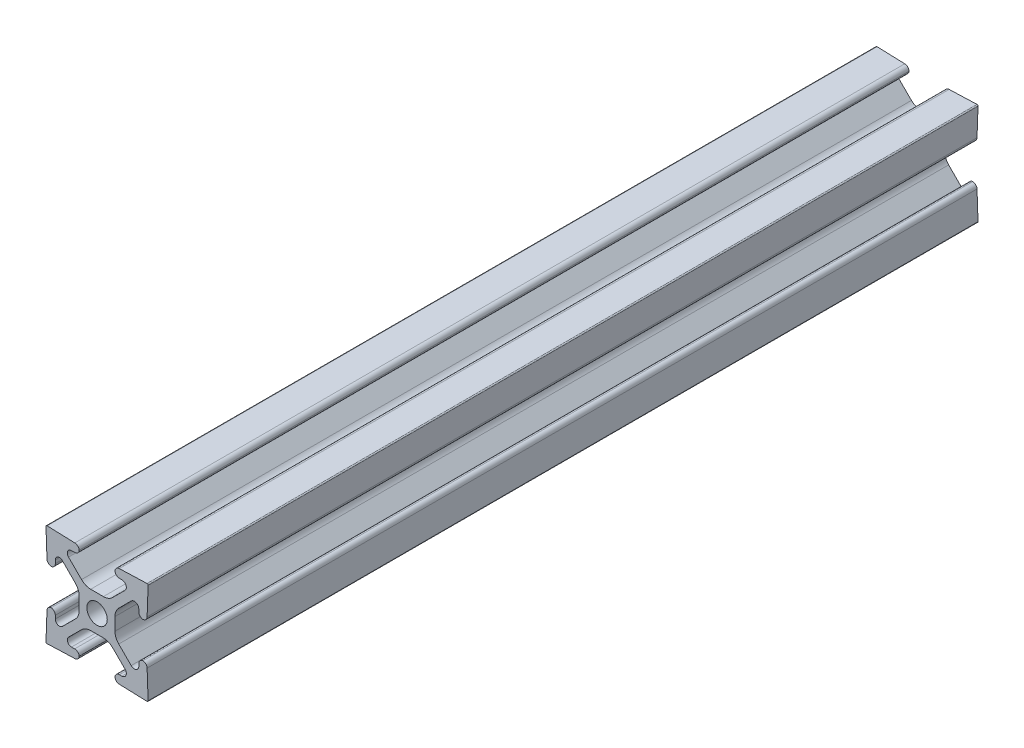
from build123d import *

# Parameters (mm, degrees)
BOSS_EXTRUDE1_DEPTH   = 203.2254
BOSS_EXTRUDE1_2_DEPTH = 203.2254
BOSS_EXTRUDE1_3_DEPTH = 203.2254
BOSS_EXTRUDE1_4_DEPTH = 203.2254
FILLET1_R             = 1.0922
FILLET2_R             = 1.0922
FILLET3_R             = 1.016
FILLET4_R             = 1.016
FILLET5_R             = 0.254
FILLET6_R             = 0.254
FILLET7_R             = 0.254
FILLET8_R             = 0.254
FILLET9_R             = 1.016
FILLET10_R            = 1.0922
FILLET11_R            = 1.0922
FILLET12_R            = 1.0922
FILLET13_R            = 1.0922
FILLET14_R            = 1.0922
SKETCH2_W             = 8.763
SKETCH2_H             = 8.763
SKETCH2_R             = 2.5019
BOSS_EXTRUDE2_DEPTH   = 203.2254
FILLET15_R            = 3.175


with BuildPart() as part:
    # Sketch1 → Boss-Extrude1 (new body)
    with BuildSketch(Plane.XY):
        Polygon((-8.714816972, 10.2235), (-4.3815, 10.2235), (-4.3815, 12.225663986), (-12.5095, 12.5095), (-12.225663986, 4.3815), (-10.2235, 4.3815), (-10.2235, 8.714816972), (-4.3815, 2.872816972), (-4.3815, 4.3815), (-2.872816972, 4.3815), align=None)
    extrude(amount=BOSS_EXTRUDE1_DEPTH)

    # Fillet1
    # the kernel refuses this fillet: 1.0922 mm, written as the material it takes off along each edge
    with BuildSketch(Plane(origin=(-4.3815, 10.2235, -2.7305), x_dir=(-1, 0, 0), z_dir=(0, 0, 1))) as fillet1_piece_1:
        with BuildLine():
            CenterArc((FILLET1_R, -FILLET1_R), FILLET1_R, 90, 90)
            Line((0, -FILLET1_R), (0, 0))
            Line((0, 0), (FILLET1_R, 0))
        make_face()
    extrude(amount=208.6864, mode=Mode.SUBTRACT)
    with BuildSketch(Plane(origin=(-4.3815, 12.225663986, -2.6368132), x_dir=(0, -1, 0), z_dir=(0, 0, 1))) as fillet1_piece_2:
        with BuildLine():
            CenterArc((FILLET1_R * 0.965688774807, -FILLET1_R), FILLET1_R, 90, 88)
            Line((-FILLET1_R * 0.033702052212, -FILLET1_R * 0.965100503298), (0, 0))
            Line((0, 0), (FILLET1_R * 0.965688774807, 0))
        make_face()
    extrude(amount=208.499026399, mode=Mode.SUBTRACT)

    # Fillet2
    # the kernel refuses this fillet: 1.0922 mm, written as the material it takes off along each edge
    with BuildSketch(Plane(origin=(-10.2235, 4.3815, -2.7305), x_dir=(0, 1, 0), z_dir=(0, 0, 1))) as fillet2_piece_1:
        with BuildLine():
            CenterArc((FILLET2_R, FILLET2_R), FILLET2_R, 180, 90)
            Line((0, FILLET2_R), (0, 0))
            Line((0, 0), (FILLET2_R, 0))
        make_face()
    extrude(amount=208.6864, mode=Mode.SUBTRACT)
    with BuildSketch(Plane(origin=(-12.225663986, 4.3815, -2.6368132), x_dir=(1, 0, 0), z_dir=(0, 0, 1))) as fillet2_piece_2:
        with BuildLine():
            CenterArc((FILLET2_R * 0.965688774807, FILLET2_R), FILLET2_R, 182, 88)
            Line((-FILLET2_R * 0.033702052212, FILLET2_R * 0.965100503298), (0, 0))
            Line((0, 0), (FILLET2_R * 0.965688774807, 0))
        make_face()
    extrude(amount=208.499026399, mode=Mode.SUBTRACT)

    # Fillet3
    fillet3_edges = [part.edges().sort_by_distance(p)[0] for p in [
        (-10.2235, 8.714816972, 101.6127),
    ]]
    fillet(fillet3_edges, radius=FILLET3_R)

    # Fillet4
    fillet4_edges = [part.edges().sort_by_distance(p)[0] for p in [
        (-8.714816972, 10.2235, 101.6127),
    ]]
    fillet(fillet4_edges, radius=FILLET4_R)

    # Fillet5
    fillet5_edges = [part.edges().sort_by_distance(p)[0] for p in [
        (-12.5095, 12.5095, 101.6127),
    ]]
    fillet(fillet5_edges, radius=FILLET5_R)



with BuildPart() as body_2:
    # Sketch1 → Boss-Extrude1 2 (new body)
    with BuildSketch(Plane.XY):
        Polygon((12.5095, 12.5095), (4.3815, 12.225663986), (4.3815, 10.2235), (8.714816972, 10.2235), (2.872816972, 4.3815), (4.3815, 4.3815), (4.3815, 2.872816972), (10.2235, 8.714816972), (10.2235, 4.3815), (12.225663986, 4.3815), align=None)
    extrude(amount=BOSS_EXTRUDE1_2_DEPTH)

    # Fillet7
    fillet7_edges = [body_2.edges().sort_by_distance(p)[0] for p in [
        (12.5095, 12.5095, 101.6127),
    ]]
    fillet(fillet7_edges, radius=FILLET7_R)

    # Fillet11
    # the kernel refuses this fillet: 1.0922 mm, written as the material it takes off along each edge
    with BuildSketch(Plane(origin=(4.3815, 10.2235, -2.7305), x_dir=(0, 1, 0), z_dir=(0, 0, 1))) as fillet11_piece_1:
        with BuildLine():
            CenterArc((FILLET11_R, -FILLET11_R), FILLET11_R, 90, 90)
            Line((0, -FILLET11_R), (0, 0))
            Line((0, 0), (FILLET11_R, 0))
        make_face()
    extrude(amount=208.6864, mode=Mode.SUBTRACT)
    with BuildSketch(Plane(origin=(4.3815, 12.225663986, -2.6368132), x_dir=(0.9993908270190961, 0.03489949670249208, 0), z_dir=(0, 0, 1))) as fillet11_piece_2:
        with BuildLine():
            CenterArc((FILLET11_R * 0.965688774807, -FILLET11_R), FILLET11_R, 90, 88)
            Line((-FILLET11_R * 0.033702052212, -FILLET11_R * 0.965100503298), (0, 0))
            Line((0, 0), (FILLET11_R * 0.965688774807, 0))
        make_face()
    extrude(amount=208.499026399, mode=Mode.SUBTRACT)
    with BuildSketch(Plane(origin=(10.2235, 4.3815, -2.7305), x_dir=(1, 0, 0), z_dir=(0, 0, 1))) as fillet11_piece_3:
        with BuildLine():
            CenterArc((FILLET11_R, FILLET11_R), FILLET11_R, 180, 90)
            Line((0, FILLET11_R), (0, 0))
            Line((0, 0), (FILLET11_R, 0))
        make_face()
    extrude(amount=208.6864, mode=Mode.SUBTRACT)
    with BuildSketch(Plane(origin=(12.225663986, 4.3815, -2.6368132), x_dir=(0.03489949670249721, 0.9993908270190958, 0), z_dir=(0, 0, 1))) as fillet11_piece_4:
        with BuildLine():
            CenterArc((FILLET11_R * 0.965688774807, FILLET11_R), FILLET11_R, 182, 88)
            Line((-FILLET11_R * 0.033702052212, FILLET11_R * 0.965100503298), (0, 0))
            Line((0, 0), (FILLET11_R * 0.965688774807, 0))
        make_face()
    extrude(amount=208.499026399, mode=Mode.SUBTRACT)

    # Fillet14
    fillet14_edges = [body_2.edges().sort_by_distance(p)[0] for p in [
        (10.2235, 8.714816972, 101.6127),
        (8.714816972, 10.2235, 101.6127),
    ]]
    fillet(fillet14_edges, radius=FILLET14_R)


with BuildPart() as body_3:
    # Sketch1 → Boss-Extrude1 3 (new body)
    with BuildSketch(Plane.XY):
        Polygon((12.5095, -12.5095), (12.225663986, -4.3815), (10.2235, -4.3815), (10.2235, -8.714816972), (4.3815, -2.872816972), (4.3815, -4.3815), (2.872816972, -4.3815), (8.714816972, -10.2235), (4.3815, -10.2235), (4.3815, -12.225663986), align=None)
    extrude(amount=BOSS_EXTRUDE1_3_DEPTH)

    # Fillet8
    fillet8_edges = [body_3.edges().sort_by_distance(p)[0] for p in [
        (12.5095, -12.5095, 101.6127),
    ]]
    fillet(fillet8_edges, radius=FILLET8_R)

    # Fillet12
    # the kernel refuses this fillet: 1.0922 mm, written as the material it takes off along each edge
    with BuildSketch(Plane(origin=(12.225663986, -4.3815, -2.6368132), x_dir=(0.03489949670249375, -0.999390827019096, 0), z_dir=(0, 0, 1))) as fillet12_piece_1:
        with BuildLine():
            CenterArc((FILLET12_R * 0.965688774807, -FILLET12_R), FILLET12_R, 90, 88)
            Line((-FILLET12_R * 0.033702052212, -FILLET12_R * 0.965100503298), (0, 0))
            Line((0, 0), (FILLET12_R * 0.965688774807, 0))
        make_face()
    extrude(amount=208.499026399, mode=Mode.SUBTRACT)
    with BuildSketch(Plane(origin=(10.2235, -4.3815, -2.7305), x_dir=(1, 0, 0), z_dir=(0, 0, 1))) as fillet12_piece_2:
        with BuildLine():
            CenterArc((FILLET12_R, -FILLET12_R), FILLET12_R, 90, 90)
            Line((0, -FILLET12_R), (0, 0))
            Line((0, 0), (FILLET12_R, 0))
        make_face()
    extrude(amount=208.6864, mode=Mode.SUBTRACT)
    with BuildSketch(Plane(origin=(4.3815, -12.225663986, -2.6368132), x_dir=(0.9993908270190958, -0.03489949670249721, 0), z_dir=(0, 0, 1))) as fillet12_piece_3:
        with BuildLine():
            CenterArc((FILLET12_R * 0.965688774807, FILLET12_R), FILLET12_R, 182, 88)
            Line((-FILLET12_R * 0.033702052212, FILLET12_R * 0.965100503298), (0, 0))
            Line((0, 0), (FILLET12_R * 0.965688774807, 0))
        make_face()
    extrude(amount=208.499026399, mode=Mode.SUBTRACT)
    with BuildSketch(Plane(origin=(4.3815, -10.2235, -2.7305), x_dir=(0, -1, 0), z_dir=(0, 0, 1))) as fillet12_piece_4:
        with BuildLine():
            CenterArc((FILLET12_R, FILLET12_R), FILLET12_R, 180, 90)
            Line((0, FILLET12_R), (0, 0))
            Line((0, 0), (FILLET12_R, 0))
        make_face()
    extrude(amount=208.6864, mode=Mode.SUBTRACT)

    # Fillet13
    fillet13_edges = [body_3.edges().sort_by_distance(p)[0] for p in [
        (8.714816972, -10.2235, 101.6127),
        (10.2235, -8.714816972, 101.6127),
    ]]
    fillet(fillet13_edges, radius=FILLET13_R)


with BuildPart() as body_4:
    # Sketch1 → Boss-Extrude1 4 (new body)
    with BuildSketch(Plane.XY):
        Polygon((-12.5095, -12.5095), (-4.3815, -12.225663986), (-4.3815, -10.2235), (-8.714816972, -10.2235), (-2.872816972, -4.3815), (-4.3815, -4.3815), (-4.3815, -2.872816972), (-10.2235, -8.714816972), (-10.2235, -4.3815), (-12.225663986, -4.3815), align=None)
    extrude(amount=BOSS_EXTRUDE1_4_DEPTH)

    # Fillet6
    fillet6_edges = [body_4.edges().sort_by_distance(p)[0] for p in [
        (-12.5095, -12.5095, 101.6127),
    ]]
    fillet(fillet6_edges, radius=FILLET6_R)

    # Fillet9
    fillet9_edges = [body_4.edges().sort_by_distance(p)[0] for p in [
        (-10.2235, -8.714816972, 101.6127),
        (-8.714816972, -10.2235, 101.6127),
    ]]
    fillet(fillet9_edges, radius=FILLET9_R)

    # Fillet10
    # the kernel refuses this fillet: 1.0922 mm, written as the material it takes off along each edge
    with BuildSketch(Plane(origin=(-4.3815, -10.2235, -2.7305), x_dir=(-1, 0, 0), z_dir=(0, 0, 1)), Plane(origin=(-10.2235, -4.3815, -2.7305), x_dir=(-1, 0, 0), z_dir=(0, 0, 1))) as fillet10_piece_1:
        with BuildLine():
            CenterArc((FILLET10_R, FILLET10_R), FILLET10_R, 180, 90)
            Line((0, FILLET10_R), (0, 0))
            Line((0, 0), (FILLET10_R, 0))
        make_face()
    extrude(amount=208.6864, mode=Mode.SUBTRACT)
    with BuildSketch(Plane(origin=(-4.3815, -12.225663986, -2.6368132), x_dir=(0, 1, 0), z_dir=(0, 0, 1)), Plane(origin=(-12.225663986, -4.3815, -2.6368132), x_dir=(-0.03489949670249721, -0.9993908270190958, 0), z_dir=(0, 0, 1))) as fillet10_piece_2:
        with BuildLine():
            CenterArc((FILLET10_R * 0.965688774807, FILLET10_R), FILLET10_R, 182, 88)
            Line((-FILLET10_R * 0.033702052212, FILLET10_R * 0.965100503298), (0, 0))
            Line((0, 0), (FILLET10_R * 0.965688774807, 0))
        make_face()
    extrude(amount=208.499026399, mode=Mode.SUBTRACT)


with BuildPart() as part_1:
    add(part.part)

    add(body_2.part)  # Boss-Extrude2 merges body 2

    add(body_3.part)  # Boss-Extrude2 merges body 3

    add(body_4.part)  # Boss-Extrude2 merges body 4
    # Sketch2 → Boss-Extrude2 (add)
    with BuildSketch(Plane.XY.offset(203.2254)):
        Rectangle(SKETCH2_W, SKETCH2_H)
        Circle(SKETCH2_R, mode=Mode.SUBTRACT)
    extrude(amount=-BOSS_EXTRUDE2_DEPTH)

    # Fillet15
    fillet15_edges = [part_1.edges().sort_by_distance(p)[0] for p in [
        (4.3815, -2.872816972, 101.6127),
        (2.872816972, -4.3815, 101.6127),
        (-2.872816972, -4.3815, 101.6127),
        (-4.3815, -2.872816972, 101.6127),
        (-2.872816972, 4.3815, 101.6127),
        (-4.3815, 2.872816972, 101.6127),
        (2.872816972, 4.3815, 101.6127),
        (4.3815, 2.872816972, 101.6127),
    ]]
    fillet(fillet15_edges, radius=FILLET15_R)


solid = part_1.part
